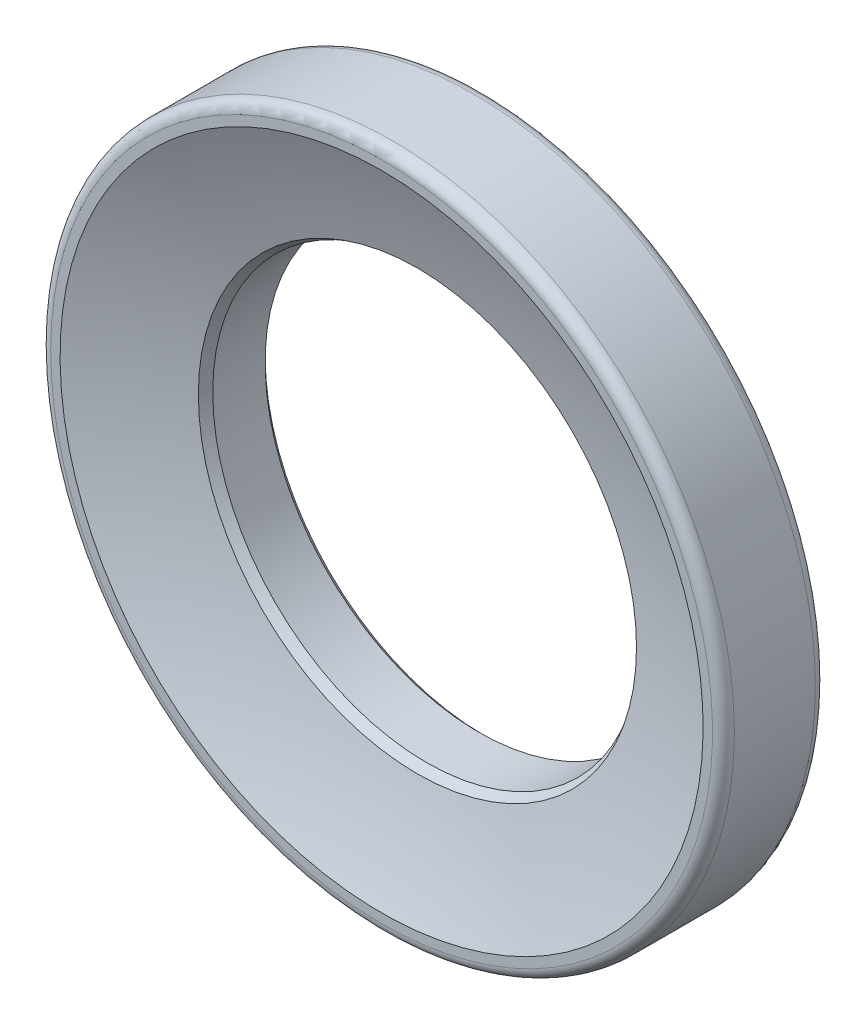
from build123d import *

# Parameters (mm, degrees)
FILLET2_R = 0.508


with BuildPart() as part:
    # Sketch1 → Revolve1 (revolve)
    with BuildSketch(Plane(origin=(0, 0, 0), x_dir=(0, 0, -1), z_dir=(1, 0, 0)), mode=Mode.PRIVATE) as revolve1_sk:
        with BuildLine():
            Line((39.8272, 15.875), (39.8272, 9.9314))
            Line((39.8272, 9.9314), (36.782839668, 9.9314))
            ThreePointArc((36.782839668, 9.9314), (36.004343784, 12.461830872), (35.052, 14.932089472))
            Line((35.052, 14.932089472), (35.052, 15.875))
            Line((35.052, 15.875), (39.8272, 15.875))
        make_face()
    revolve(revolve1_sk.sketch.rotate(Axis((0, 0, 0), (0, 0, -1)), 90), axis=Axis((0, 0, 0), (0, 0, -1)))

    # Chamfer1: read off the stored shape, not the designer's step
    # Chamfer1 outline → Chamfer1 (revolve, cut)
    with BuildSketch(Plane.XZ):
        Polygon((9.9314, -36.716530911), (9.9314, -37.142376439), (10.173807442, -36.716530911), align=None)
        Polygon((9.9314, -39.5732), (9.9314, -39.8272), (10.1854, -39.8272), align=None)
    revolve(axis=Axis((0, 0, 0), (0, 0, 1)), mode=Mode.SUBTRACT)

    # Fillet2
    fillet2_edges = [part.edges().sort_by_distance(p)[0] for p in [
        (-15.875, 0, -39.8272),
        (-15.875, 0, -35.052),
    ]]
    fillet(fillet2_edges, radius=FILLET2_R)


solid = part.part
